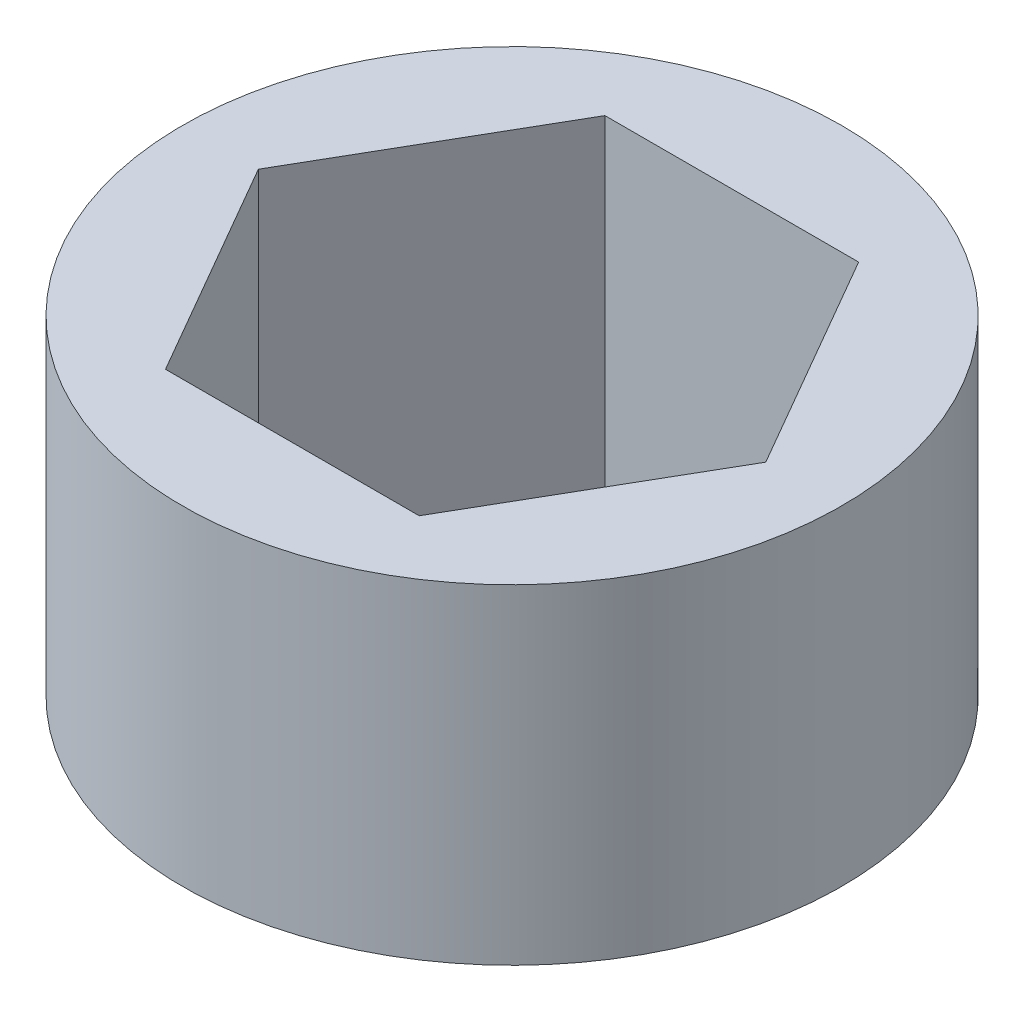
from build123d import *

# Parameters (mm, degrees)
SKETCH1_R           = 9.525
BOSS_EXTRUDE1_DEPTH = 9.525


with BuildPart() as part:
    # Sketch1 → Boss-Extrude1 (new body)
    with BuildSketch(Plane(origin=(0, 0, 0), x_dir=(1, 0, 0), z_dir=(0, 1, 0))):
        Circle(SKETCH1_R)
        Polygon((3.666174209, 6.35), (-3.666174209, 6.35), (-7.332348419, 0), (-3.666174209, -6.35), (3.666174209, -6.35), (7.332348419, 0), align=None, mode=Mode.SUBTRACT)
    extrude(amount=BOSS_EXTRUDE1_DEPTH)


solid = part.part
